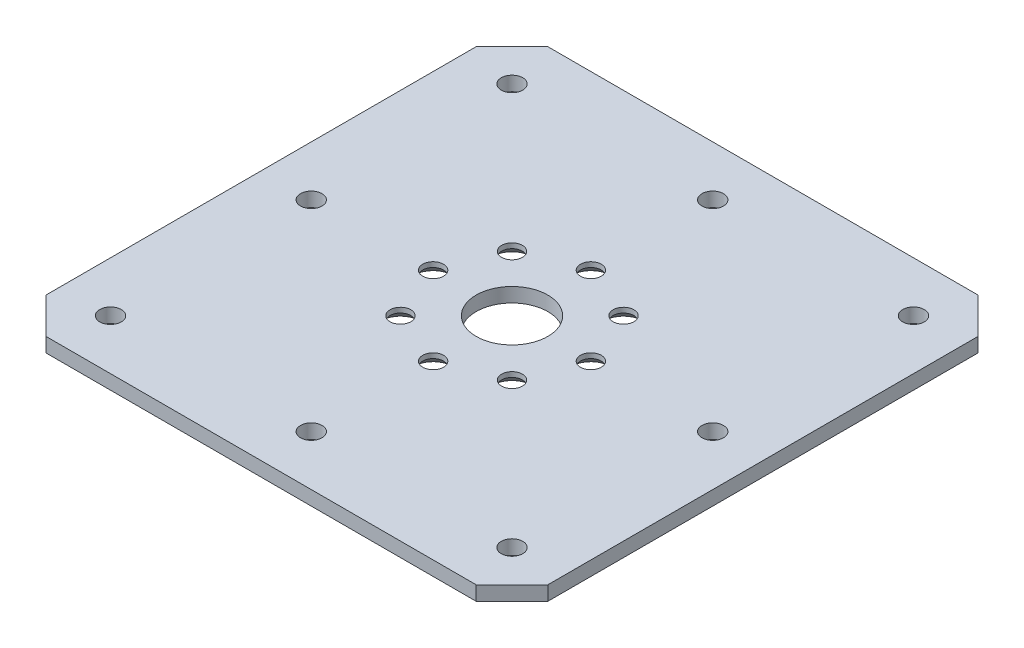
from build123d import *

# Parameters (mm, degrees)
SKETCH1_W                                    = 70
SKETCH1_H                                    = 2
BASE_FLANGE1_DEPTH                           = 70
SKETCH3_R                                    = 5
CUT_EXTRUDE1_DEPTH                           = 79.287930104
CHAMFER1_SIZE                                = 5
SKETCH4_R                                    = 1.25
CUT_EXTRUDE2_DEPTH                           = 79.287930104
CSK_FOR_M2_5_COUNTERSUNK_RAISED_HEAD_2_COUNT = 2
CSK_FOR_M2_5_COUNTERSUNK_RAISED_HEAD_2_PITCH = 8.419035512
CSK_FOR_M2_5_COUNTERSUNK_RAISED_HEAD_3_COUNT = 2
CSK_FOR_M2_5_COUNTERSUNK_RAISED_HEAD_3_PITCH = 15.556349186
CSK_FOR_M2_5_COUNTERSUNK_RAISED_HEAD_4_COUNT = 2
CSK_FOR_M2_5_COUNTERSUNK_RAISED_HEAD_4_PITCH = 20.325349715
CSK_FOR_M2_5_COUNTERSUNK_RAISED_HEAD_5_COUNT = 2
CSK_FOR_M2_5_COUNTERSUNK_RAISED_HEAD_5_PITCH = 22
CSK_FOR_M2_5_COUNTERSUNK_RAISED_HEAD_6_COUNT = 2
CSK_FOR_M2_5_COUNTERSUNK_RAISED_HEAD_6_PITCH = 20.325349715
CSK_FOR_M2_5_COUNTERSUNK_RAISED_HEAD_7_COUNT = 2
CSK_FOR_M2_5_COUNTERSUNK_RAISED_HEAD_7_PITCH = 15.556349186
CSK_FOR_M2_5_COUNTERSUNK_RAISED_HEAD_8_COUNT = 2
CSK_FOR_M2_5_COUNTERSUNK_RAISED_HEAD_8_PITCH = 8.419035512
SKETCH6_R                                    = 1.5
CUT_EXTRUDE3_DEPTH                           = 79.287930104


# Sheet-metal steps are written as plain solids
with BuildPart() as part:
    # Sketch1 → Base-Flange1 (new body)
    with BuildSketch(Plane.XY):
        with Locations((0, -1)):
            Rectangle(SKETCH1_W, SKETCH1_H)
    extrude(amount=BASE_FLANGE1_DEPTH)

    # Sketch3 → Cut-Extrude1 (cut, through all)
    with BuildSketch(Plane(origin=(0, 0, 0), x_dir=(1, 0, 0), z_dir=(0, 1, 0))):
        with Locations(Location((0, -35, 0), (0, 0, 270))):
            Circle(SKETCH3_R)
    extrude(amount=-CUT_EXTRUDE1_DEPTH, mode=Mode.SUBTRACT)

    # Chamfer1
    chamfer1_edges = [part.edges().sort_by_distance(p)[0] for p in [
        (-35, -1, 70),
        (-35, -1, 0),
        (35, -1, 0),
        (35, -1, 70),
    ]]
    chamfer(chamfer1_edges, length=CHAMFER1_SIZE)

    # Sketch4 → Cut-Extrude2 (cut, through all)
    with BuildSketch(Plane(origin=(0, 0, 0), x_dir=(1, 0, 0), z_dir=(0, 1, 0))):
        with Locations(Location((11, -35, 0), (0, 0, 270))):
            Circle(SKETCH4_R)
        with Locations(Location((-11, -35, 0), (0, 0, 270))):
            Circle(SKETCH4_R)
        with Locations(Location((0, -46, 0), (0, 0, 270))):
            Circle(SKETCH4_R)
        with Locations(Location((0, -24, 0), (0, 0, 270))):
            Circle(SKETCH4_R)
        with Locations(Location((7.778174593, -42.778174593, 0), (0, 0, 270))):
            Circle(SKETCH4_R)
        with Locations(Location((7.778174593, -27.221825407, 0), (0, 0, 270))):
            Circle(SKETCH4_R)
        with Locations(Location((-7.778174593, -27.221825407, 0), (0, 0, 270))):
            Circle(SKETCH4_R)
        with Locations(Location((-7.778174593, -42.778174593, 0), (0, 0, 270))):
            Circle(SKETCH4_R)
    extrude(amount=-CUT_EXTRUDE2_DEPTH, mode=Mode.SUBTRACT)

    # Sketch5 → CSK for M2.5 Countersunk Raised Head Screw1 (revolve, cut)
    with BuildSketch(Plane(origin=(0, -2, 46), x_dir=(0, 0, -1), z_dir=(1, 0, 0))):
        Polygon((0, 0), (0, 2), (1.45, 2), (1.45, 1.3), (2.75, 0), align=None)
    csk_for_m2_5_countersunk_raised_head_scr = revolve(axis=Axis((0, -8.35, 46), (0, 1, 0)), mode=Mode.SUBTRACT)

    # CSK for M2.5 Countersunk Raised Head 2: CSK for M2.5 Countersunk Raised Head Screw1 ×2
    with Locations(*[Vector(-0.9238795325112854, 0, -0.382683432365093) * (i * CSK_FOR_M2_5_COUNTERSUNK_RAISED_HEAD_2_PITCH) for i in range(1, CSK_FOR_M2_5_COUNTERSUNK_RAISED_HEAD_2_COUNT)]):
        add(csk_for_m2_5_countersunk_raised_head_scr, mode=Mode.SUBTRACT)

    # CSK for M2.5 Countersunk Raised Head 3: CSK for M2.5 Countersunk Raised Head Screw1 ×2
    with Locations(*[Vector(-0.7071067811865474, 0, -0.7071067811865478) * (i * CSK_FOR_M2_5_COUNTERSUNK_RAISED_HEAD_3_PITCH) for i in range(1, CSK_FOR_M2_5_COUNTERSUNK_RAISED_HEAD_3_COUNT)]):
        add(csk_for_m2_5_countersunk_raised_head_scr, mode=Mode.SUBTRACT)

    # CSK for M2.5 Countersunk Raised Head 4: CSK for M2.5 Countersunk Raised Head Screw1 ×2
    with Locations(*[Vector(-0.3826834323650891, 0, -0.9238795325112871) * (i * CSK_FOR_M2_5_COUNTERSUNK_RAISED_HEAD_4_PITCH) for i in range(1, CSK_FOR_M2_5_COUNTERSUNK_RAISED_HEAD_4_COUNT)]):
        add(csk_for_m2_5_countersunk_raised_head_scr, mode=Mode.SUBTRACT)

    # CSK for M2.5 Countersunk Raised Head 5: CSK for M2.5 Countersunk Raised Head Screw1 ×2
    with Locations(*[(0, 0, -i * CSK_FOR_M2_5_COUNTERSUNK_RAISED_HEAD_5_PITCH) for i in range(1, CSK_FOR_M2_5_COUNTERSUNK_RAISED_HEAD_5_COUNT)]):
        add(csk_for_m2_5_countersunk_raised_head_scr, mode=Mode.SUBTRACT)

    # CSK for M2.5 Countersunk Raised Head 6: CSK for M2.5 Countersunk Raised Head Screw1 ×2
    with Locations(*[Vector(0.3826834323650891, 0, -0.9238795325112871) * (i * CSK_FOR_M2_5_COUNTERSUNK_RAISED_HEAD_6_PITCH) for i in range(1, CSK_FOR_M2_5_COUNTERSUNK_RAISED_HEAD_6_COUNT)]):
        add(csk_for_m2_5_countersunk_raised_head_scr, mode=Mode.SUBTRACT)

    # CSK for M2.5 Countersunk Raised Head 7: CSK for M2.5 Countersunk Raised Head Screw1 ×2
    with Locations(*[Vector(0.7071067811865474, 0, -0.7071067811865478) * (i * CSK_FOR_M2_5_COUNTERSUNK_RAISED_HEAD_7_PITCH) for i in range(1, CSK_FOR_M2_5_COUNTERSUNK_RAISED_HEAD_7_COUNT)]):
        add(csk_for_m2_5_countersunk_raised_head_scr, mode=Mode.SUBTRACT)

    # CSK for M2.5 Countersunk Raised Head 8: CSK for M2.5 Countersunk Raised Head Screw1 ×2
    with Locations(*[Vector(0.9238795325112854, 0, -0.382683432365093) * (i * CSK_FOR_M2_5_COUNTERSUNK_RAISED_HEAD_8_PITCH) for i in range(1, CSK_FOR_M2_5_COUNTERSUNK_RAISED_HEAD_8_COUNT)]):
        add(csk_for_m2_5_countersunk_raised_head_scr, mode=Mode.SUBTRACT)

    # Sketch6 → Cut-Extrude3 (cut, through all)
    with BuildSketch(Plane(origin=(0, 0, 0), x_dir=(1, 0, 0), z_dir=(0, 1, 0))):
        with Locations(Location((-28, -7, 0), (0, 0, 270))):
            Circle(SKETCH6_R)
        with Locations(Location((0, -7, 0), (0, 0, 270))):
            Circle(SKETCH6_R)
        with Locations(Location((28, -7, 0), (0, 0, 270))):
            Circle(SKETCH6_R)
        with Locations(Location((28, -35, 0), (0, 0, 270))):
            Circle(SKETCH6_R)
        with Locations(Location((28, -63, 0), (0, 0, 270))):
            Circle(SKETCH6_R)
        with Locations(Location((0, -63, 0), (0, 0, 270))):
            Circle(SKETCH6_R)
        with Locations(Location((-28, -63, 0), (0, 0, 270))):
            Circle(SKETCH6_R)
        with Locations(Location((-28, -35, 0), (0, 0, 270))):
            Circle(SKETCH6_R)
    extrude(amount=-CUT_EXTRUDE3_DEPTH, mode=Mode.SUBTRACT)


solid = part.part
